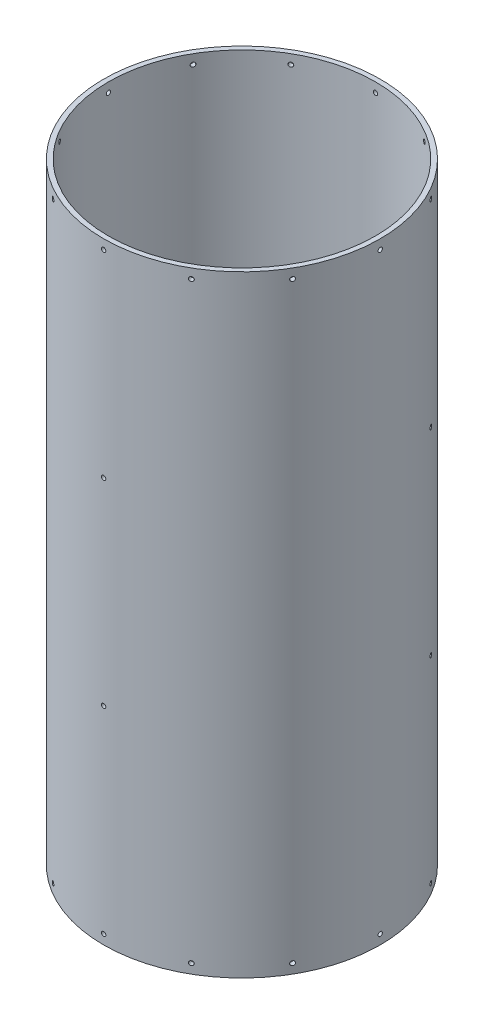
from build123d import *

# Parameters (mm, degrees)
SKETCH1_R                = 92.075
SKETCH1_R_2              = 88.9
BOSS_EXTRUDE1_DEPTH      = 203.581
SKETCH3_R                = 1.4351
CUT_EXTRUDE1_DEPTH       = 19.304
CIRPATTERN1_COUNT        = 12
MIRROR1_COPY_1_SKETCH_R  = 1.4351
MIRROR1_COPY_1_DEPTH     = 19.304
MIRROR1_COPY_2_SKETCH_R  = 1.4351
MIRROR1_COPY_2_DEPTH     = 19.304
MIRROR1_COPY_3_SKETCH_R  = 1.4351
MIRROR1_COPY_3_DEPTH     = 19.304
MIRROR1_COPY_4_SKETCH_R  = 1.4351
MIRROR1_COPY_4_DEPTH     = 19.304
MIRROR1_COPY_5_SKETCH_R  = 1.4351
MIRROR1_COPY_5_DEPTH     = 19.304
MIRROR1_COPY_6_SKETCH_R  = 1.4351
MIRROR1_COPY_6_DEPTH     = 19.304
MIRROR1_COPY_7_SKETCH_R  = 1.4351
MIRROR1_COPY_7_DEPTH     = 19.304
MIRROR1_COPY_8_SKETCH_R  = 1.4351
MIRROR1_COPY_8_DEPTH     = 19.304
MIRROR1_COPY_9_SKETCH_R  = 1.4351
MIRROR1_COPY_9_DEPTH     = 19.304
MIRROR1_COPY_10_SKETCH_R = 1.4351
MIRROR1_COPY_10_DEPTH    = 19.304
MIRROR1_COPY_11_SKETCH_R = 1.4351
MIRROR1_COPY_11_DEPTH    = 19.304
SKETCH4_R                = 1.4351
CUT_EXTRUDE2_DEPTH       = 43.18
CIRPATTERN2_COUNT        = 3


with BuildPart() as part:
    # Sketch1 → Boss-Extrude1 (new, symmetric)
    with BuildSketch(Plane(origin=(0, 0, 0), x_dir=(1, 0, 0), z_dir=(0, 1, 0))):
        Circle(SKETCH1_R)
        Circle(SKETCH1_R_2, mode=Mode.SUBTRACT)
    extrude(amount=BOSS_EXTRUDE1_DEPTH, both=True)

    # Sketch3 → Cut-Extrude1 (cut)
    with BuildSketch(Plane.XY.offset(92.075)):
        with Locations((0, -197.231)):
            Circle(SKETCH3_R)
    cut_extrude1 = extrude(amount=-CUT_EXTRUDE1_DEPTH, mode=Mode.SUBTRACT)

    # CirPattern1: Cut-Extrude1 ×12 about axis
    cirpattern1_axis = Axis((0, 203.581, 0), (0, -1, 0))
    for i in range(1, CIRPATTERN1_COUNT):
        add(cut_extrude1.rotate(cirpattern1_axis, i * 360 / CIRPATTERN1_COUNT), mode=Mode.SUBTRACT)

    # Mirror1: Cut-Extrude1 across plane
    add(cut_extrude1.mirror(Plane.ZX), mode=Mode.SUBTRACT)

    # Mirror1 copy 1 sketch → Mirror1 copy 1 (cut)
    with BuildSketch(Plane(origin=(-46.0375, 0, 79.739289053), x_dir=(0.8660254037844387, 0, 0.49999999999999994), z_dir=(-0.49999999999999994, 0, 0.8660254037844387))):
        with Locations((0, 197.231)):
            Circle(MIRROR1_COPY_1_SKETCH_R)
    extrude(amount=-MIRROR1_COPY_1_DEPTH, mode=Mode.SUBTRACT)

    # Mirror1 copy 2 sketch → Mirror1 copy 2 (cut)
    with BuildSketch(Plane(origin=(-79.739289053, 0, 46.0375), x_dir=(0.5000000000000001, 0, 0.8660254037844386), z_dir=(-0.8660254037844386, 0, 0.5000000000000001))):
        with Locations((0, 197.231)):
            Circle(MIRROR1_COPY_2_SKETCH_R)
    extrude(amount=-MIRROR1_COPY_2_DEPTH, mode=Mode.SUBTRACT)

    # Mirror1 copy 3 sketch → Mirror1 copy 3 (cut)
    with BuildSketch(Plane.ZY.offset(92.075)):
        with Locations((0, 197.231)):
            Circle(MIRROR1_COPY_3_SKETCH_R)
    extrude(amount=-MIRROR1_COPY_3_DEPTH, mode=Mode.SUBTRACT)

    # Mirror1 copy 4 sketch → Mirror1 copy 4 (cut)
    with BuildSketch(Plane(origin=(-79.739289053, 0, -46.0375), x_dir=(-0.4999999999999998, 0, 0.8660254037844387), z_dir=(-0.8660254037844387, 0, -0.4999999999999998))):
        with Locations((0, 197.231)):
            Circle(MIRROR1_COPY_4_SKETCH_R)
    extrude(amount=-MIRROR1_COPY_4_DEPTH, mode=Mode.SUBTRACT)

    # Mirror1 copy 5 sketch → Mirror1 copy 5 (cut)
    with BuildSketch(Plane(origin=(-46.0375, 0, -79.739289053), x_dir=(-0.8660254037844387, 0, 0.49999999999999994), z_dir=(-0.49999999999999994, 0, -0.8660254037844387))):
        with Locations((0, 197.231)):
            Circle(MIRROR1_COPY_5_SKETCH_R)
    extrude(amount=-MIRROR1_COPY_5_DEPTH, mode=Mode.SUBTRACT)

    # Mirror1 copy 6 sketch → Mirror1 copy 6 (cut)
    with BuildSketch(Plane(origin=(0, 0, -92.075), x_dir=(-1, 0, 0), z_dir=(0, 0, -1))):
        with Locations((0, 197.231)):
            Circle(MIRROR1_COPY_6_SKETCH_R)
    extrude(amount=-MIRROR1_COPY_6_DEPTH, mode=Mode.SUBTRACT)

    # Mirror1 copy 7 sketch → Mirror1 copy 7 (cut)
    with BuildSketch(Plane(origin=(46.0375, 0, -79.739289053), x_dir=(-0.8660254037844386, 0, -0.5000000000000001), z_dir=(0.5000000000000001, 0, -0.8660254037844386))):
        with Locations((0, 197.231)):
            Circle(MIRROR1_COPY_7_SKETCH_R)
    extrude(amount=-MIRROR1_COPY_7_DEPTH, mode=Mode.SUBTRACT)

    # Mirror1 copy 8 sketch → Mirror1 copy 8 (cut)
    with BuildSketch(Plane(origin=(79.739289053, 0, -46.0375), x_dir=(-0.5000000000000004, 0, -0.8660254037844384), z_dir=(0.8660254037844384, 0, -0.5000000000000004))):
        with Locations((0, 197.231)):
            Circle(MIRROR1_COPY_8_SKETCH_R)
    extrude(amount=-MIRROR1_COPY_8_DEPTH, mode=Mode.SUBTRACT)

    # Mirror1 copy 9 sketch → Mirror1 copy 9 (cut)
    with BuildSketch(Plane(origin=(92.075, 0, 0), x_dir=(0, 0, -1), z_dir=(1, 0, 0))):
        with Locations((0, 197.231)):
            Circle(MIRROR1_COPY_9_SKETCH_R)
    extrude(amount=-MIRROR1_COPY_9_DEPTH, mode=Mode.SUBTRACT)

    # Mirror1 copy 10 sketch → Mirror1 copy 10 (cut)
    with BuildSketch(Plane(origin=(79.739289053, 0, 46.0375), x_dir=(0.5000000000000001, 0, -0.8660254037844386), z_dir=(0.8660254037844386, 0, 0.5000000000000001))):
        with Locations((0, 197.231)):
            Circle(MIRROR1_COPY_10_SKETCH_R)
    extrude(amount=-MIRROR1_COPY_10_DEPTH, mode=Mode.SUBTRACT)

    # Mirror1 copy 11 sketch → Mirror1 copy 11 (cut)
    with BuildSketch(Plane(origin=(46.0375, 0, 79.739289053), x_dir=(0.8660254037844384, 0, -0.5000000000000004), z_dir=(0.5000000000000004, 0, 0.8660254037844384))):
        with Locations((0, 197.231)):
            Circle(MIRROR1_COPY_11_SKETCH_R)
    extrude(amount=-MIRROR1_COPY_11_DEPTH, mode=Mode.SUBTRACT)

    # Sketch4 → Cut-Extrude2 (cut)
    with BuildSketch(Plane.XY.offset(92.075)):
        with Locations((0, 65.7606)):
            Circle(SKETCH4_R)
        with Locations((0, -65.7606)):
            Circle(SKETCH4_R)
    cut_extrude2 = extrude(amount=-CUT_EXTRUDE2_DEPTH, mode=Mode.SUBTRACT)

    # CirPattern2: Cut-Extrude2 ×3 about axis
    cirpattern2_axis = Axis((0, 203.581, 0), (0, -1, 0))
    for i in range(1, CIRPATTERN2_COUNT):
        add(cut_extrude2.rotate(cirpattern2_axis, i * 360 / CIRPATTERN2_COUNT), mode=Mode.SUBTRACT)


solid = part.part
